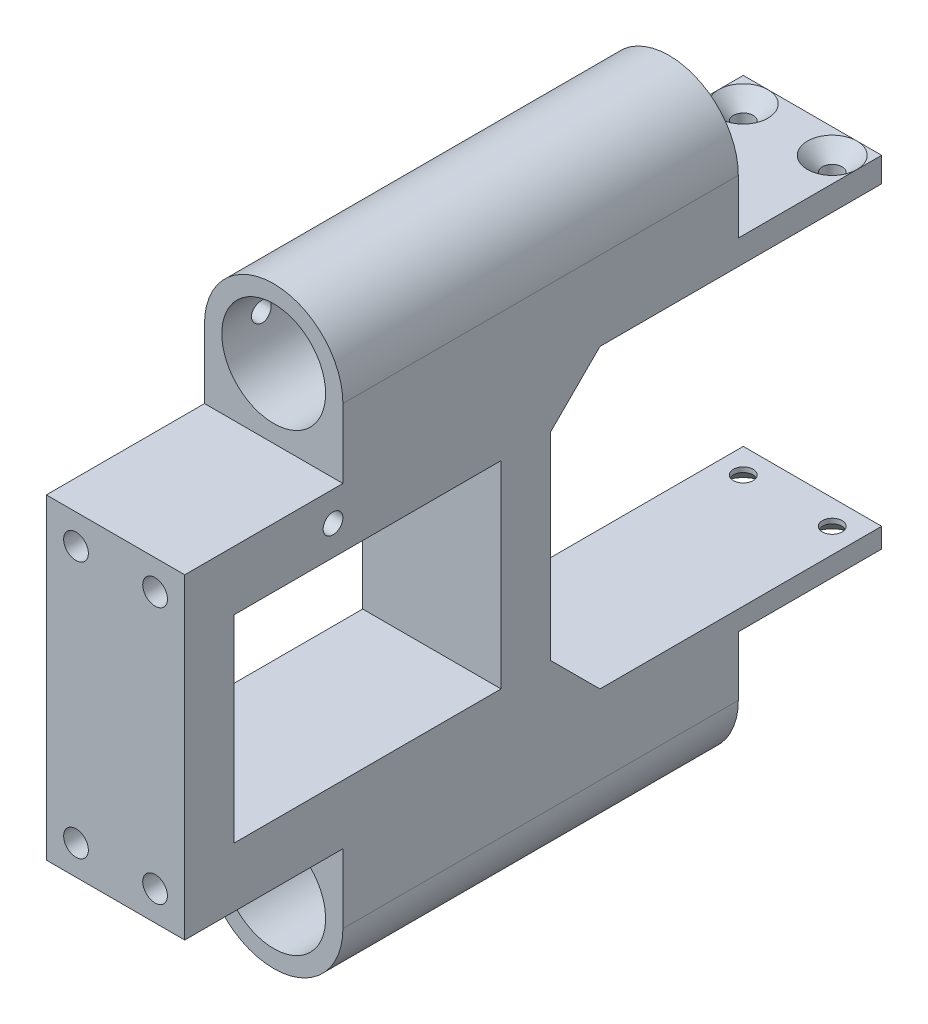
from build123d import *

# Parameters (mm, degrees)
SKETCH_1_W               = 28
SKETCH_1_H               = 64
EXTRUDE_1_DEPTH          = 74
SKETCH_2_R               = 2.5
CUT_EXTRUDE_1_DEPTH      = 10
CUT_EXTRUDE_2_DEPTH      = 99.833192805
CUT_EXTRUDE_2_DEPTH_BACK = 99.833192805
SKETCH_3_W               = 54
SKETCH_3_H               = 40
EXTRUDE_2_DEPTH          = 80
SKETCH_6_R               = 10.5
CUT_EXTRUDE_3_DEPTH      = 123.719191653
SKETCH_11_W              = 28
SKETCH_11_H              = 5
SKETCH_11_H_2            = 4
EXTRUDE_5_DEPTH          = 67
SKETCH_12_R              = 2
CUT_EXTRUDE_8_DEPTH      = 122.231184107
CHAMFER_1_SIZE           = 10
SKETCH_13_R              = 10.5
SKETCH_13_R_2            = 9.5
EXTRUDE_6_DEPTH          = 25
SKETCH_14_R              = 2
CUT_EXTRUDE_9_DEPTH      = 119.894911582
SKETCH_15_R              = 2
CUT_EXTRUDE_10_DEPTH     = 122.342490596
CHAMFER_2_SIZE           = 3


with BuildPart() as part:
    # 草图1 → 凸台-拉伸1 (new body)
    with BuildSketch(Plane.XY):
        with Locations((0, 32)):
            Rectangle(SKETCH_1_W, SKETCH_1_H)
    extrude(amount=EXTRUDE_1_DEPTH)

    # 草图2 → 切除-拉伸1 (cut)
    with BuildSketch(Plane.XY.offset(74)):
        with Locations((-8, 58)):
            Circle(SKETCH_2_R)
        with Locations((8, 58)):
            Circle(SKETCH_2_R)
        with Locations((-8, 6)):
            Circle(SKETCH_2_R)
        with Locations((8, 6)):
            Circle(SKETCH_2_R)
    extrude(amount=-CUT_EXTRUDE_1_DEPTH, mode=Mode.SUBTRACT)

    # 草图3 → 切除-拉伸2 (cut, two sides: drawn at the far end of the back side and taken through both)
    with BuildSketch(Plane(origin=(0, 0, 0), x_dir=(0, 0, -1), z_dir=(1, 0, 0)).offset(-CUT_EXTRUDE_2_DEPTH_BACK)):
        with Locations((-37, 32)):
            Rectangle(SKETCH_3_W, SKETCH_3_H)
    extrude(amount=CUT_EXTRUDE_2_DEPTH + CUT_EXTRUDE_2_DEPTH_BACK, mode=Mode.SUBTRACT)

    # 草图4 → 凸台-拉伸2 (add)
    with BuildSketch(Plane(origin=(0, 0, 42), x_dir=(-1, 0, 0), z_dir=(0, 0, -1))):
        with BuildLine():
            Line((-14, 2), (14, 2))
            Line((14, 2), (14, -14))
            ThreePointArc((14, -14), (0, -28), (-14, -14))
            Line((-14, -14), (-14, 2))
        make_face()
        with BuildLine():
            Line((14, 62), (14, 78))
            ThreePointArc((14, 78), (0, 92), (-14, 78))
            Line((-14, 78), (-14, 62))
            Line((-14, 62), (14, 62))
        make_face()
    extrude(amount=EXTRUDE_2_DEPTH)

    # 草图6 → 切除-拉伸3 (cut, through all)
    with BuildSketch(Plane(origin=(0, 0, 42), x_dir=(-1, 0, 0), z_dir=(0, 0, -1))):
        with Locations((0, -14)):
            Circle(SKETCH_6_R)
        with Locations(Location((0, 78, 0), (0, 0, 180))):
            Circle(SKETCH_6_R)
    extrude(amount=CUT_EXTRUDE_3_DEPTH, mode=Mode.SUBTRACT)

    # 草图11 → 凸台-拉伸5 (add)
    with BuildSketch(Plane(origin=(0, 0, 0), x_dir=(-1, 0, 0), z_dir=(0, 0, -1))):
        with Locations((0, 64.5)):
            Rectangle(SKETCH_11_W, SKETCH_11_H)
        Rectangle(SKETCH_11_W, SKETCH_11_H_2)
    extrude(amount=EXTRUDE_5_DEPTH)

    # 草图12 → 切除-拉伸8 (cut, through all)
    with BuildSketch(Plane(origin=(0, 67, 0), x_dir=(1, 0, 0), z_dir=(0, 1, 0))):
        with Locations(Location((-9, 62, 0), (0, 0, 270))):
            Circle(SKETCH_12_R)
        with Locations(Location((9, 62, 0), (0, 0, 270))):
            Circle(SKETCH_12_R)
    extrude(amount=-CUT_EXTRUDE_8_DEPTH, mode=Mode.SUBTRACT)

    # 倒角1
    chamfer_1_edges = [part.edges().sort_by_distance(p)[0] for p in [
        (0, 62, 0),
        (0, 2, 0),
    ]]
    chamfer(chamfer_1_edges, length=CHAMFER_1_SIZE)

    # 草图13 → 凸台-拉伸6 (add, symmetric)
    # profile 1 of 2: a face of its own
    with BuildSketch(Plane.XY.offset(2)):
        with Locations((0, 78)):
            Circle(SKETCH_13_R)
        with Locations((0, 78)):
            Circle(SKETCH_13_R_2, mode=Mode.SUBTRACT)
    # profile 2 of 2: a face of its own
    with BuildSketch(Plane.XY.offset(2)):
        with Locations(Location((0, -14, 0), (0, 0, 180))):
            Circle(SKETCH_13_R)
        with Locations(Location((0, -14, 0), (0, 0, 180))):
            Circle(SKETCH_13_R_2, mode=Mode.SUBTRACT)
    extrude(amount=EXTRUDE_6_DEPTH, both=True)

    # 草图14 → 切除-拉伸9 (cut, through all)
    with BuildSketch(Plane(origin=(0, 0, 0), x_dir=(0, 0, -1), z_dir=(1, 0, 0))):
        with Locations((-34, 78)):
            Circle(SKETCH_14_R)
        with Locations((30, 78)):
            Circle(SKETCH_14_R)
        with Locations((30, -14)):
            Circle(SKETCH_14_R)
        with Locations((-34, -14)):
            Circle(SKETCH_14_R)
    extrude(amount=-CUT_EXTRUDE_9_DEPTH, mode=Mode.SUBTRACT)

    # 草图15 → 切除-拉伸10 (cut, through all)
    with BuildSketch(Plane.ZY.offset(14)):
        with Locations(Location((44, 58, 0), (0, 0, 270))):
            Circle(SKETCH_15_R)
    extrude(amount=-CUT_EXTRUDE_10_DEPTH, mode=Mode.SUBTRACT)

    # 倒角2
    chamfer_2_edges = [part.edges().sort_by_distance(p)[0] for p in [
        (-9, -2, -64),
        (-9, 67, -64),
        (9, -2, -64),
        (9, 67, -64),
    ]]
    chamfer(chamfer_2_edges, length=CHAMFER_2_SIZE - 0.0001)  # a hair under: the kernel refuses the full size


solid = part.part
